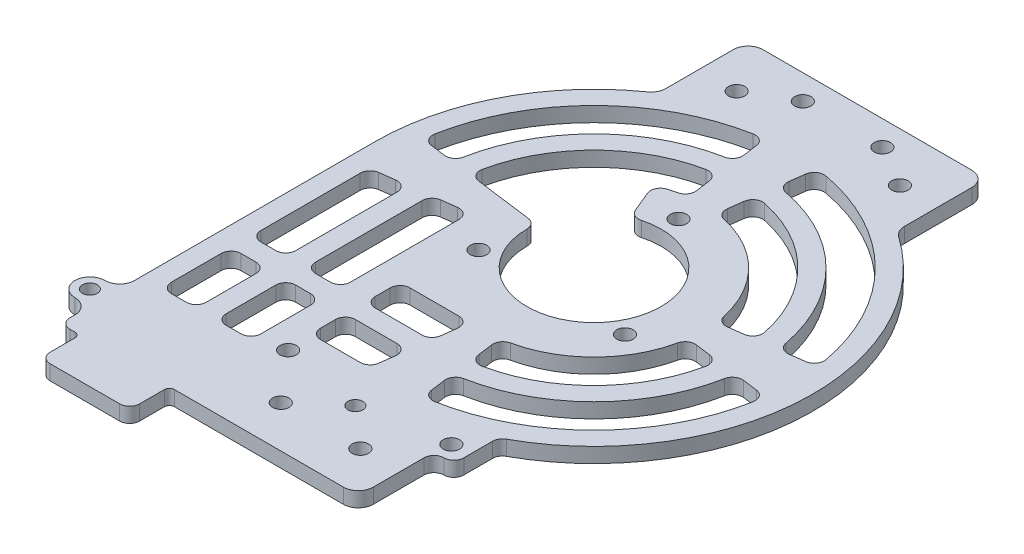
from build123d import *

# Parameters (mm, degrees)
SKETCH_1_R          = 1.65
EXTRUDE_1_DEPTH     = 3
SKETCH_2_W          = 7
SKETCH_2_H          = 14
CUT_EXTRUDE_1_DEPTH = 5
FILLET_1_R          = 2
SKETCH_4_R          = 1.5
CUT_EXTRUDE_2_DEPTH = 3
EXTRUDE_START       = -3
SKETCH_6_R          = 1.65
SKETCH_6_W          = 32
SKETCH_6_H          = 13
EXTRUDE_3_DEPTH     = 3
SKETCH_7_R          = 1.65
CUT_EXTRUDE_3_DEPTH = 79.549347547
CUT_EXTRUDE_START   = -10
CUT_EXTRUDE_4_DEPTH = 10
FILLET_4_R          = 2
SKETCH_9_W          = 28
SKETCH_9_H          = 11.4
EXTRUDE_4_DEPTH     = 3
SKETCH_10_W         = 32
SKETCH_10_H         = 1.6
CUT_EXTRUDE_5_DEPTH = 4
SKETCH_11_W         = 6
SKETCH_11_H         = 6
SKETCH_11_R         = 1.5
EXTRUDE_5_DEPTH     = 3
SKETCH_12_W         = 18
SKETCH_12_H         = 8
EXTRUDE_6_DEPTH     = 3
FILLET_5_R          = 3
FILLET_6_R          = 2
FILLET_7_R          = 1


with BuildPart() as part:
    # 草图1 → 凸台-拉伸1 (new body)
    with BuildSketch(Plane(origin=(0, 0, 0), x_dir=(1, 0, 0), z_dir=(0, 1, 0))):
        with BuildLine():
            ThreePointArc((44, 0), (0, 44), (-44, 0))
            Line((-44, 0), (-44, -52))
            Line((-44, -52), (16, -52))
            ThreePointArc((16, -52), (36.555057081, -29.52964612), (44, 0))
        make_face()
        with Locations(Location((-14.722431864, -8.5, 0), (0, 0, 270))):
            Circle(SKETCH_1_R, mode=Mode.SUBTRACT)
        with BuildLine():
            ThreePointArc((4.307364343, -32.717680425), (23.334523779, -23.334523779), (32.717680425, -4.307364343))
            Line((32.717680425, -4.307364343), (39.657794455, -5.221047689))
            ThreePointArc((39.657794455, -5.221047689), (28.284271247, -28.284271247), (5.221047689, -39.657794455))
            Line((5.221047689, -39.657794455), (4.307364343, -32.717680425))
        make_face(mode=Mode.SUBTRACT)
        with BuildLine():
            ThreePointArc((2.871576229, -21.81178695), (15.556349186, -15.556349186), (21.81178695, -2.871576229))
            Line((21.81178695, -2.871576229), (28.75190098, -3.785259574))
            ThreePointArc((28.75190098, -3.785259574), (20.506096654, -20.506096654), (3.785259574, -28.75190098))
            Line((3.785259574, -28.75190098), (2.871576229, -21.81178695))
        make_face(mode=Mode.SUBTRACT)
        with Locations(Location((14.722431864, -8.5, 0), (0, 0, 270))):
            Circle(SKETCH_1_R, mode=Mode.SUBTRACT)
        with BuildLine():
            Line((-5.221047689, 39.657794455), (-4.307364343, 32.717680425))
            ThreePointArc((-4.307364343, 32.717680425), (-23.334523779, 23.334523779), (-32.717680425, 4.307364343))
            Line((-32.717680425, 4.307364343), (-39.657794455, 5.221047689))
            ThreePointArc((-39.657794455, 5.221047689), (-28.284271247, 28.284271247), (-5.221047689, 39.657794455))
        make_face(mode=Mode.SUBTRACT)
        with BuildLine():
            Line((-13.384505629, 1.762103595), (-28.75190098, 3.785259574))
            ThreePointArc((-28.75190098, 3.785259574), (-20.506096654, 20.506096654), (-3.785259574, 28.75190098))
            Line((-3.785259574, 28.75190098), (-2.871576229, 21.81178695))
            ThreePointArc((-2.871576229, 21.81178695), (-5.694018992, 21.250368178), (-8.419035512, 20.325349715))
            Line((-8.419035512, 20.325349715), (-5.166226337, 12.472373689))
            ThreePointArc((-5.166226337, 12.472373689), (10.710270094, -8.218279292), (-13.384505629, 1.762103595))
        make_face(mode=Mode.SUBTRACT)
        with BuildLine():
            Line((28.75190098, 3.785259574), (21.81178695, 2.871576229))
            ThreePointArc((21.81178695, 2.871576229), (15.556349186, 15.556349186), (2.871576229, 21.81178695))
            Line((2.871576229, 21.81178695), (3.785259574, 28.75190098))
            ThreePointArc((3.785259574, 28.75190098), (20.506096654, 20.506096654), (28.75190098, 3.785259574))
        make_face(mode=Mode.SUBTRACT)
        with Locations(Location((0, 17, 0), (0, 0, 270))):
            Circle(SKETCH_1_R, mode=Mode.SUBTRACT)
        with BuildLine():
            Line((39.657794455, 5.221047689), (32.717680425, 4.307364343))
            ThreePointArc((32.717680425, 4.307364343), (23.334523779, 23.334523779), (4.307364343, 32.717680425))
            Line((4.307364343, 32.717680425), (5.221047689, 39.657794455))
            ThreePointArc((5.221047689, 39.657794455), (28.284271247, 28.284271247), (39.657794455, 5.221047689))
        make_face(mode=Mode.SUBTRACT)
    extrude(amount=EXTRUDE_1_DEPTH)

    # 草图2 → 切除-拉伸1 (cut)
    with BuildSketch(Plane(origin=(0, 3, 0), x_dir=(1, 0, 0), z_dir=(0, 1, 0))):
        Polygon((-29, -3.81792243), (-29, -29), (-22, -29), (-22, -2.896354947), align=None)
        Polygon((-33, -4.34453242), (-33, -29), (-40, -29), (-40, -5.266099903), align=None)
        Polygon((-3.81792243, -29), (-17, -29), (-17, -22), (-2.896354947, -22), align=None)
        Polygon((-4.34453242, -33), (-17, -33), (-17, -40), (-5.266099903, -40), align=None)
        with Locations((-36.5, -40)):
            Rectangle(SKETCH_2_W, SKETCH_2_H)
        with Locations((-25.5, -40)):
            Rectangle(SKETCH_2_W, SKETCH_2_H)
    extrude(amount=-CUT_EXTRUDE_1_DEPTH, mode=Mode.SUBTRACT)

    # 圆角1
    fillet_1_edges = [part.edges().sort_by_distance(p)[0] for p in [
        (-17, 1.5, 29),
        (-17, 1.5, 22),
        (-2.896354947, 1.5, 22),
        (-3.81792243, 1.5, 29),
        (-40, 1.5, 5.266099903),
        (-33, 1.5, 4.34453242),
        (-33, 1.5, 29),
        (-40, 1.5, 29),
        (-29, 1.5, 47),
        (-29, 1.5, 33),
        (-22, 1.5, 33),
        (-22, 1.5, 47),
        (-33, 1.5, 33),
        (-33, 1.5, 47),
        (-40, 1.5, 47),
        (-40, 1.5, 33),
        (-29, 1.5, 3.81792243),
        (-22, 1.5, 2.896354947),
        (-22, 1.5, 29),
        (-29, 1.5, 29),
        (-4.34453242, 1.5, 33),
        (-5.266099903, 1.5, 40),
        (-17, 1.5, 40),
        (-17, 1.5, 33),
        (3.785259574, 1.5, 28.75190098),
        (28.75190098, 1.5, 3.785259574),
        (21.81178695, 1.5, 2.871576229),
        (2.871576229, 1.5, 21.81178695),
        (5.221047689, 1.5, -39.657794455),
        (4.307364343, 1.5, -32.717680425),
        (32.717680425, 1.5, -4.307364343),
        (39.657794455, 1.5, -5.221047689),
        (-28.75190098, 1.5, -3.785259574),
        (-13.384505629, 1.5, -1.762103595),
        (-5.166226337, 1.5, -12.472373689),
        (-8.419035512, 1.5, -20.325349715),
        (-2.871576229, 1.5, -21.81178695),
        (-3.785259574, 1.5, -28.75190098),
        (-39.657794455, 1.5, -5.221047689),
        (-32.717680425, 1.5, -4.307364343),
        (-4.307364343, 1.5, -32.717680425),
        (-5.221047689, 1.5, -39.657794455),
        (39.657794455, 1.5, 5.221047689),
        (32.717680425, 1.5, 4.307364343),
        (4.307364343, 1.5, 32.717680425),
        (5.221047689, 1.5, 39.657794455),
        (28.75190098, 1.5, -3.785259574),
        (3.785259574, 1.5, -28.75190098),
        (2.871576229, 1.5, -21.81178695),
        (21.81178695, 1.5, -2.871576229),
    ]]
    fillet(fillet_1_edges, radius=FILLET_1_R)

    # 草图4 → 切除-拉伸2 (cut)
    with BuildSketch(Plane(origin=(0, 3, 0), x_dir=(1, 0, 0), z_dir=(0, 1, 0))):
        with Locations(Location((0, -48, 0), (0, 0, 270))):
            Circle(SKETCH_4_R)
    extrude(amount=-CUT_EXTRUDE_2_DEPTH, mode=Mode.SUBTRACT)

    # 草图6 → 凸台-拉伸3 (add)
    # profile 1 of 2: a face of its own
    with BuildSketch(Plane(origin=(0, 3, 0), x_dir=(1, 0, 0), z_dir=(0, 1, 0)).offset(EXTRUDE_START)):
        with BuildLine():
            Line((-24, 36.878177829), (-24, 55))
            Line((-24, 55), (24, 55))
            Line((24, 55), (24, 36.878177829))
            ThreePointArc((24, 36.878177829), (0, 44), (-24, 36.878177829))
        make_face()
        with Locations(Location((-8, 50, 0), (0, 0, 270))):
            Circle(SKETCH_6_R, mode=Mode.SUBTRACT)
        with Locations(Location((8, 50, 0), (0, 0, 90))):
            Circle(SKETCH_6_R, mode=Mode.SUBTRACT)
        with Locations(Location((16.41696688, 45.105245798, 0), (0, 0, 270))):
            Circle(SKETCH_6_R, mode=Mode.SUBTRACT)
        with Locations(Location((-16.41696688, 45.105245798, 0), (0, 0, 90))):
            Circle(SKETCH_6_R, mode=Mode.SUBTRACT)
    # profile 2 of 2: a face of its own
    with BuildSketch(Plane(origin=(0, 3, 0), x_dir=(1, 0, 0), z_dir=(0, 1, 0)).offset(EXTRUDE_START)):
        with Locations((0, -58.5)):
            Rectangle(SKETCH_6_W, SKETCH_6_H)
        with Locations(Location((-8, -55, 0), (0, 0, 270))):
            Circle(SKETCH_6_R, mode=Mode.SUBTRACT)
        with Locations(Location((8, -55, 0), (0, 0, 90))):
            Circle(SKETCH_6_R, mode=Mode.SUBTRACT)
    extrude(amount=EXTRUDE_3_DEPTH)

    # 草图7 → 切除-拉伸3 (cut, through all)
    with BuildSketch(Plane(origin=(0, 3, 0), x_dir=(1, 0, 0), z_dir=(0, 1, 0))):
        with Locations(Location((-16.41696688, -45.105245798, 0), (0, 0, 90))):
            Circle(SKETCH_7_R)
        with Locations(Location((16.41696688, -45.105245798, 0), (0, 0, 90))):
            Circle(SKETCH_7_R)
    extrude(amount=-CUT_EXTRUDE_3_DEPTH, mode=Mode.SUBTRACT)

    # 草图8 → 切除-拉伸4 (cut)
    with BuildSketch(Plane(origin=(0, 3, 0), x_dir=(1, 0, 0), z_dir=(0, 1, 0)).offset(CUT_EXTRUDE_START)):
        with BuildLine():
            Line((16, -48.191835885), (16, -52))
            ThreePointArc((16, -52), (36.555057081, -29.52964612), (44, 0))
            ThreePointArc((44, 0), (37.523326079, -22.978250586), (20, -39.191835885))
            Line((20, -39.191835885), (20, -48.191835885))
            Line((20, -48.191835885), (16, -48.191835885))
        make_face()
    extrude(amount=CUT_EXTRUDE_4_DEPTH, mode=Mode.SUBTRACT)

    # 圆角4
    fillet_4_edges = [part.edges().sort_by_distance(p)[0] for p in [
        (20, 1.5, 39.191835885),
        (16, 1.5, 48.191835885),
        (20, 1.5, 48.191835885),
    ]]
    fillet(fillet_4_edges, radius=FILLET_4_R - 0.0001)  # a hair under: the kernel refuses the full size

    # 草图9 → 凸台-拉伸4 (add)
    with BuildSketch(Plane(origin=(0, 3, 0), x_dir=(1, 0, 0), z_dir=(0, 1, 0))):
        with Locations((-30, -57.7)):
            Rectangle(SKETCH_9_W, SKETCH_9_H)
    extrude(amount=-EXTRUDE_4_DEPTH)

    # 草图10 → 切除-拉伸5 (cut)
    with BuildSketch(Plane(origin=(0, 3, 0), x_dir=(1, 0, 0), z_dir=(0, 1, 0))):
        with Locations((0, -64.2)):
            Rectangle(SKETCH_10_W, SKETCH_10_H)
    extrude(amount=-CUT_EXTRUDE_5_DEPTH, mode=Mode.SUBTRACT)

    # 草图11 → 凸台-拉伸5 (add)
    with BuildSketch(Plane(origin=(0, 3, 0), x_dir=(1, 0, 0), z_dir=(0, 1, 0))):
        with Locations((-47, -54.4)):
            Rectangle(SKETCH_11_W, SKETCH_11_H)
        with Locations(Location((-47, -54.4, 0), (0, 0, 270))):
            Circle(SKETCH_11_R, mode=Mode.SUBTRACT)
    extrude(amount=-EXTRUDE_5_DEPTH)

    # 草图12 → 凸台-拉伸6 (add)
    with BuildSketch(Plane(origin=(0, 3, 0), x_dir=(1, 0, 0), z_dir=(0, 1, 0))):
        with Locations((-31, -67.4)):
            Rectangle(SKETCH_12_W, SKETCH_12_H)
    extrude(amount=-EXTRUDE_6_DEPTH)

    # 圆角5
    fillet_5_edges = [part.edges().sort_by_distance(p)[0] for p in [
        (24, 1.5, -36.878177829),
        (-24, 1.5, -36.878177829),
        (-24, 1.5, -55),
        (24, 1.5, -55),
        (16, 1.5, 63.4),
        (-44, 1.5, 51.4),
        (-44, 1.5, 57.4),
        (-50, 1.5, 57.4),
        (-50, 1.5, 51.4),
    ]]
    fillet(fillet_5_edges, radius=FILLET_5_R - 0.0001)  # a hair under: the kernel refuses the full size

    # 圆角6
    fillet_6_edges = [part.edges().sort_by_distance(p)[0] for p in [
        (-44, 1.5, 63.4),
        (-22, 1.5, 71.4),
        (-40, 1.5, 71.4),
    ]]
    fillet(fillet_6_edges, radius=FILLET_6_R)

    # 圆角7
    fillet_7_edges = [part.edges().sort_by_distance(p)[0] for p in [
        (-40, 1.5, 63.4),
        (-22, 1.5, 63.4),
    ]]
    fillet(fillet_7_edges, radius=FILLET_7_R)


solid = part.part
